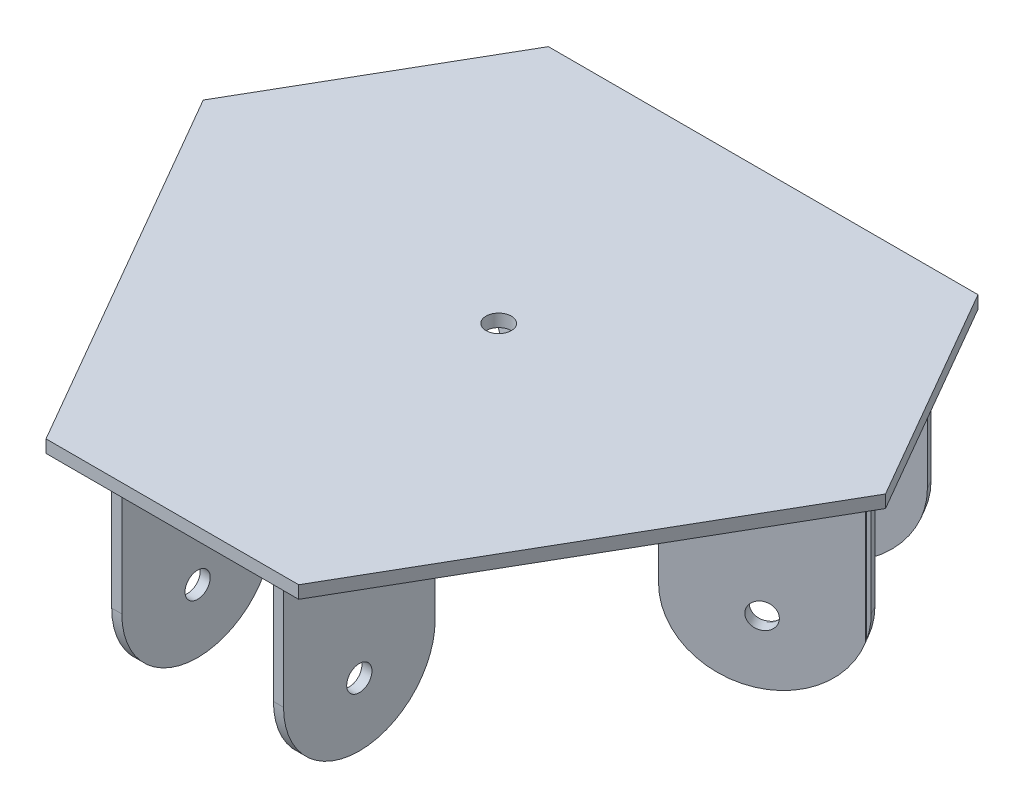
from build123d import *
from build123d.topology import SkipClean

# Parameters (mm, degrees)
BOSS_EXTRUDE1_DEPTH     = 2.5
SKETCH2_W               = 4
SKETCH2_H               = 60
BOSS_EXTRUDE2_DEPTH     = 80
CUT_EXTRUDE1_START      = -50
SKETCH4_R               = 5
CUT_EXTRUDE1_DEPTH      = 277.937399591
SKETCH5_R               = 5
CUT_EXTRUDE2_DEPTH      = 50
CIRPATTERN5_START       = 30.789632312
CIRPATTERN5_OUTLINE_W   = 60
CIRPATTERN5_OUTLINE_H   = 80
CIRPATTERN5_OUTLINE_R   = 5
CIRPATTERN5_DEPTH       = 4
CIRPATTERN5_START_2     = 29.210367688
CIRPATTERN5_2_OUTLINE_W = 60
CIRPATTERN5_2_OUTLINE_H = 80
CIRPATTERN5_2_OUTLINE_R = 5
CIRPATTERN5_2_DEPTH     = 4
CIRPATTERN6_START       = -33.867687061
CIRPATTERN6_OUTLINE_W   = 60
CIRPATTERN6_OUTLINE_H   = 80
CIRPATTERN6_OUTLINE_R   = 5
CIRPATTERN6_DEPTH       = 4
CIRPATTERN6_START_2     = 29.98519923
CIRPATTERN6_2_OUTLINE_W = 60
CIRPATTERN6_2_OUTLINE_H = 80
CIRPATTERN6_2_DEPTH     = 4
CIRPATTERN6_START_3     = -34.64059617
CIRPATTERN6_3_OUTLINE_W = 60
CIRPATTERN6_3_OUTLINE_H = 80
CIRPATTERN6_3_OUTLINE_R = 5
CIRPATTERN6_3_DEPTH     = 4
CIRPATTERN6_START_4     = 30.022960672
CIRPATTERN6_4_OUTLINE_W = 60
CIRPATTERN6_4_OUTLINE_H = 80
CIRPATTERN6_4_DEPTH     = 4
CIRPATTERN6_5_OUTLINE_R = 5
CIRPATTERN6_5_DEPTH     = 0.663556842
CUT_EXTRUDE3_START      = -50
SKETCH7_R               = 5
CUT_EXTRUDE3_DEPTH      = 50
CUT_EXTRUDE4_DEPTH      = 231.175674448
CUT_EXTRUDE4_DEPTH_BACK = 231.175674448
SKETCH8_R               = 5
FILLET1_RADIUS          = 30
FILLET1_LENGTH          = 4
FILLET5_RADIUS          = 30
FILLET5_LENGTH          = 4
FILLET6_R               = 30.699015
FILLET7_RADIUS          = 30
FILLET7_LENGTH          = 4
FILLET8_RADIUS          = 30
FILLET8_LENGTH          = 4
FILLET9_R               = 30.701371
SKETCH9_R               = 5
CUT_EXTRUDE5_DEPTH      = 10


# Read off the part's stored shape, not the designer's step: CirPattern5, CirPattern6
with BuildPart() as part:
    # Sketch1 → Boss-Extrude1 (new, symmetric)
    with BuildSketch(Plane(origin=(0, 0, 0), x_dir=(1, 0, 0), z_dir=(0, 1, 0))):
        Polygon((-135, 20.207259422), (-85, 106.8097998), (85, 106.8097998), (135, 20.207259422), (50, -127.017059222), (0, -127.017059222), (-50, -127.017059222), align=None)
    extrude(amount=BOSS_EXTRUDE1_DEPTH, both=True)

    # Sketch2 → Boss-Extrude2 (add)
    with BuildSketch(Plane.XZ.offset(2.5)):
        with Locations((-32, 87.017059222)):
            Rectangle(SKETCH2_W, SKETCH2_H)
    boss_extrude2 = extrude(amount=BOSS_EXTRUDE2_DEPTH)

    # Mirror1: Boss-Extrude2 across plane
    add(boss_extrude2.mirror(Plane(origin=(0, 0, 0), x_dir=(0, 0, 1), z_dir=(1, 0, 0))))

    # Sketch4 → Cut-Extrude1 (cut)
    with BuildSketch(Plane.ZY.offset(34).offset(CUT_EXTRUDE1_START)):
        with Locations(Location((87.017059222, -57.5, 0), (0, 0, 180))):
            Circle(SKETCH4_R)
    extrude(amount=CUT_EXTRUDE1_DEPTH, mode=Mode.SUBTRACT)

    # Sketch5 → Cut-Extrude2 (cut)
    with BuildSketch(Plane(origin=(34, 0, 0), x_dir=(0, 0, -1), z_dir=(1, 0, 0))):
        with Locations((-87.017059222, -57.5)):
            Circle(SKETCH5_R)
    extrude(amount=-CUT_EXTRUDE2_DEPTH, mode=Mode.SUBTRACT)

    # CirPattern5 outline → CirPattern5 (add)
    with BuildSketch(Plane(origin=(0, 0, 0), x_dir=(0.8660254037844362, 0, 0.5000000000000042), z_dir=(0.5000000000000042, 0, -0.8660254037844363)).offset(CIRPATTERN5_START)):
        with Locations((-88.384742505, 42.5)):
            Rectangle(CIRPATTERN5_OUTLINE_W, CIRPATTERN5_OUTLINE_H)
        with Locations((-87.833146876, 57.5)):
            Circle(CIRPATTERN5_OUTLINE_R, mode=Mode.SUBTRACT)
    extrude(amount=CIRPATTERN5_DEPTH)

    # CirPattern5 2 outline → CirPattern5 2 (add)
    with BuildSketch(Plane(origin=(0, 0, 0), x_dir=(0.8660254037844431, 0, -0.4999999999999921), z_dir=(0.4999999999999921, 0, 0.8660254037844433)).offset(CIRPATTERN5_START_2)):
        with Locations((88.384742505, -42.5)):
            Rectangle(CIRPATTERN5_2_OUTLINE_W, CIRPATTERN5_2_OUTLINE_H)
        with Locations((87.539689415, -57.5)):
            Circle(CIRPATTERN5_2_OUTLINE_R, mode=Mode.SUBTRACT)
    extrude(amount=CIRPATTERN5_2_DEPTH)

    # CirPattern6 outline → CirPattern6 (add)
    with BuildSketch(Plane(origin=(0, 0, 0), x_dir=(0.8660254037844362, 0, 0.5000000000000042), z_dir=(0.5000000000000042, 0, -0.8660254037844363)).offset(CIRPATTERN6_START)):
        with Locations((-87.833146876, 42.5)):
            Rectangle(CIRPATTERN6_OUTLINE_W, CIRPATTERN6_OUTLINE_H)
        with Locations((-86.982001293, 57.5)):
            Circle(CIRPATTERN6_OUTLINE_R, mode=Mode.SUBTRACT)
    extrude(amount=CIRPATTERN6_DEPTH)

    # CirPattern6 2 outline → CirPattern6 2 (add)
    with BuildSketch(Plane(origin=(0, 0, 0), x_dir=(0.8660254037844362, 0, 0.5000000000000042), z_dir=(0.5000000000000042, 0, -0.8660254037844363)).offset(CIRPATTERN6_START_2)):
        with Locations((-86.982001293, 42.5)):
            Rectangle(CIRPATTERN6_2_OUTLINE_W, CIRPATTERN6_2_OUTLINE_H)
    extrude(amount=CIRPATTERN6_2_DEPTH)

    # CirPattern6 3 outline → CirPattern6 3 (add)
    with BuildSketch(Plane(origin=(0, 0, 0), x_dir=(0.8660254037844431, 0, -0.4999999999999921), z_dir=(0.4999999999999921, 0, 0.8660254037844433)).offset(CIRPATTERN6_START_3)):
        with Locations((87.539689415, -42.5)):
            Rectangle(CIRPATTERN6_3_OUTLINE_W, CIRPATTERN6_3_OUTLINE_H)
        with Locations((86.986712415, -57.5)):
            Circle(CIRPATTERN6_3_OUTLINE_R, mode=Mode.SUBTRACT)
    extrude(amount=CIRPATTERN6_3_DEPTH)

    # CirPattern6 4 outline → CirPattern6 4 (add)
    with BuildSketch(Plane(origin=(0, 0, 0), x_dir=(0.8660254037844431, 0, -0.4999999999999921), z_dir=(0.4999999999999921, 0, 0.8660254037844433)).offset(CIRPATTERN6_START_4)):
        with Locations((86.986712415, -42.5)):
            Rectangle(CIRPATTERN6_4_OUTLINE_W, CIRPATTERN6_4_OUTLINE_H)
    extrude(amount=CIRPATTERN6_4_DEPTH)

    # CirPattern6 5 outline → CirPattern6 5 (add)
    with BuildSketch(Plane(origin=(0, 0, 0), x_dir=(0.8660254037844431, 0, -0.4999999999999921), z_dir=(0.4999999999999921, 0, 0.8660254037844433)).offset(CIRPATTERN6_START_3)):
        with Locations((86.986712415, -57.5)):
            Circle(CIRPATTERN6_5_OUTLINE_R)
    extrude(amount=CIRPATTERN6_5_DEPTH)

    # Sketch7 → Cut-Extrude3 (cut)
    with BuildSketch(Plane(origin=(17.394816156, 0, -30.128705371), x_dir=(-0.8660254037844363, 0, -0.5000000000000042), z_dir=(0.5000000000000042, 0, -0.8660254037844363)).offset(CUT_EXTRUDE3_START)):
        with Locations(Location((87.833146876, -57.5, 0), (0, 0, 180))):
            Circle(SKETCH7_R)
    extrude(amount=CUT_EXTRUDE3_DEPTH, mode=Mode.SUBTRACT)

    # Sketch8 → Cut-Extrude4 (cut, two sides: drawn at the far end of the back side and taken through both)
    with SkipClean():  # the faces are left unmerged after this step: merging them gives an invalid solid
        with BuildSketch(Plane(origin=(-15.320298085, 0, -26.535534671), x_dir=(0.8660254037844431, 0, -0.4999999999999922), z_dir=(0.4999999999999922, 0, 0.8660254037844431)).offset(-CUT_EXTRUDE4_DEPTH_BACK)):
            with Locations(Location((86.986712415, -57.5, 0), (0, 0, 180))):
                Circle(SKETCH8_R)
        extrude(amount=CUT_EXTRUDE4_DEPTH + CUT_EXTRUDE4_DEPTH_BACK, mode=Mode.SUBTRACT)
    add(part.part.scale(1), mode=Mode.REPLACE)  # the faces are merged on a copy

    # Fillet1: full round fillet: the end face becomes a half cylinder, R = half its width
    fillet1_face = Plane((-32, -82.5, 87.017059222), x_dir=(1, 0, 0), z_dir=(0, -1, 0))  # on the end face: x along it, z out of the body
    fillet1_slab = fillet1_face.offset(-FILLET1_RADIUS / 2) * Box(FILLET1_LENGTH, 2 * FILLET1_RADIUS, FILLET1_RADIUS, mode=Mode.PRIVATE)  # the body's end, R deep
    fillet1_round = Plane((-32, -52.5, 87.017059222), x_dir=(0, -1, 0), z_dir=(1, 0, 0)) * Cylinder(FILLET1_RADIUS, FILLET1_LENGTH, mode=Mode.PRIVATE)  # its axis R under the face
    add(fillet1_slab - fillet1_round, mode=Mode.SUBTRACT)

    # Fillet5: full round fillet: the end face becomes a half cylinder, R = half its width
    fillet5_face = Plane((32, -82.5, 87.017059222), x_dir=(-1, 0, 0), z_dir=(0, -1, 0))  # on the end face: x along it, z out of the body
    fillet5_slab = fillet5_face.offset(-FILLET5_RADIUS / 2) * Box(FILLET5_LENGTH, 2 * FILLET5_RADIUS, FILLET5_RADIUS, mode=Mode.PRIVATE)  # the body's end, R deep
    fillet5_round = Plane((32, -52.5, 87.017059222), x_dir=(0, -1, 0), z_dir=(-1, 0, 0)) * Cylinder(FILLET5_RADIUS, FILLET5_LENGTH, mode=Mode.PRIVATE)  # its axis R under the face
    add(fillet5_slab - fillet5_round, mode=Mode.SUBTRACT)

    # Fillet6
    fillet6_edges = [part.edges().sort_by_distance(p)[0] for p in [
        (65.363420966, -82.5, -0.760658761),
        (118.129378274, -82.5, -32.163399973),
    ]]
    fillet(fillet6_edges, radius=FILLET6_R)

    # Fillet7: full round fillet: the end face becomes a half cylinder, R = half its width
    fillet7_face = Plane((59.491296788, -82.5, -72.037430185), x_dir=(0.5, 0, 0.866025403784), z_dir=(0, -1, 0))  # on the end face: x along it, z out of the body
    fillet7_slab = fillet7_face.offset(-FILLET7_RADIUS / 2) * Box(FILLET7_LENGTH, 2 * FILLET7_RADIUS, FILLET7_RADIUS, mode=Mode.PRIVATE)  # the body's end, R deep
    fillet7_round = Plane((59.491296788, -52.5, -72.037430185), x_dir=(0, -1, 0), z_dir=(0.5, 0, 0.866025403784)) * Cylinder(FILLET7_RADIUS, FILLET7_LENGTH, mode=Mode.PRIVATE)  # its axis R under the face
    add(fillet7_slab - fillet7_round, mode=Mode.SUBTRACT)

    # Fillet8: full round fillet: the end face becomes a half cylinder, R = half its width
    fillet8_face = Plane((-91.999580019, -82.5, -16.318346883), x_dir=(0.5, 0, -0.866025403784), z_dir=(0, -1, 0))  # on the end face: x along it, z out of the body
    fillet8_slab = fillet8_face.offset(-FILLET8_RADIUS / 2) * Box(FILLET8_LENGTH, 2 * FILLET8_RADIUS, FILLET8_RADIUS, mode=Mode.PRIVATE)  # the body's end, R deep
    fillet8_round = Plane((-91.999580019, -52.5, -16.318346883), x_dir=(0, -1, 0), z_dir=(0.5, 0, -0.866025403784)) * Cylinder(FILLET8_RADIUS, FILLET8_LENGTH, mode=Mode.PRIVATE)  # its axis R under the face
    add(fillet8_slab - fillet8_round, mode=Mode.SUBTRACT)

    # Fillet9
    fillet9_edges = [part.edges().sort_by_distance(p)[0] for p in [
        (-33.355261063, -82.5, -56.190995725),
        (-86.129378274, -82.5, -87.589025815),
    ]]
    fillet(fillet9_edges, radius=FILLET9_R - 0.0001)  # a hair under: the kernel refuses the full size

    # Sketch9 → Cut-Extrude5 (cut)
    with BuildSketch(Plane(origin=(0, 2.5, 0), x_dir=(1, 0, 0), z_dir=(0, 1, 0))):
        with Locations(Location((0, 2.14084421, 0), (0, 0, 270))):
            Circle(SKETCH9_R)
    extrude(amount=-CUT_EXTRUDE5_DEPTH, mode=Mode.SUBTRACT)


solid = part.part
